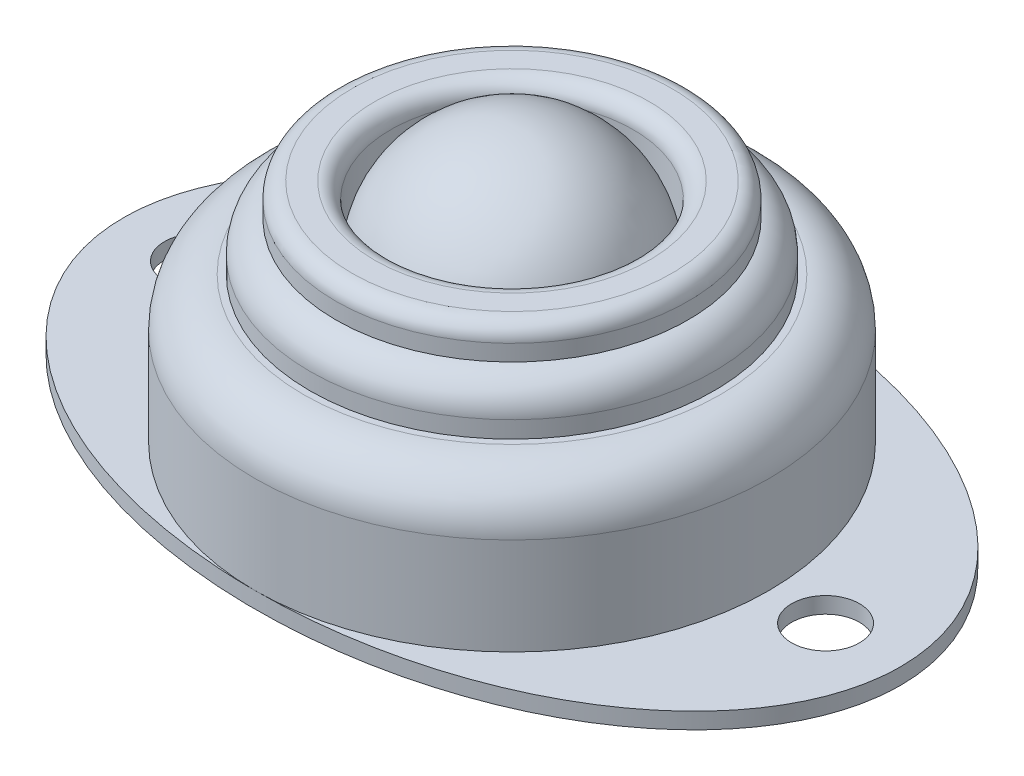
from build123d import *

# Parameters (mm, degrees)
SKETCH_1_RX         = 24.05
SKETCH_1_RY         = 15.9
SKETCH_1_R          = 2.1
EXTRUDE_1_DEPTH     = 1
SKETCH_1_3_R        = 15.9
EXTRUDE_2_DEPTH     = 15
SKETCH_2_R          = 7.5
CUT_EXTRUDE_2_DEPTH = 12
SKETCH_5_R          = 7.5
EXTRUDE_4_DEPTH     = 15
FILLET_4_R          = 7.5
CUT_EXTRUDE_START   = -5
SKETCH_6_R          = 15.9
SKETCH_6_R_2        = 12.5
CUT_EXTRUDE_3_DEPTH = 5
CUT_EXTRUDE_START_2 = -2
SKETCH_7_R          = 12.5
SKETCH_7_R_2        = 10.9
CUT_EXTRUDE_4_DEPTH = 2
FILLET_5_R          = 1
FILLET_8_R          = 3
FILLET_9_R          = 2


# Some blends are built 0.0001 mm under size
with BuildPart() as part:
    # 草图1 → 凸台-拉伸1 (new body)
    with BuildSketch(Plane(origin=(0, 0, 0), x_dir=(1, 0, 0), z_dir=(0, 1, 0))):
        with Locations((0, 0)):
            Ellipse(SKETCH_1_RX, SKETCH_1_RY)
        with Locations(Location((-19.4, 0, 0), (0, 0, 270))):
            Circle(SKETCH_1_R, mode=Mode.SUBTRACT)
        with Locations(Location((19.4, 0, 0), (0, 0, 270))):
            Circle(SKETCH_1_R, mode=Mode.SUBTRACT)
    extrude(amount=EXTRUDE_1_DEPTH)

    # 草图1<3> → 凸台-拉伸2 (add)
    with BuildSketch(Plane(origin=(0, 0, 0), x_dir=(1, 0, 0), z_dir=(0, 1, 0))):
        with Locations(Location((0, 0, 0), (0, 0, 270))):
            Circle(SKETCH_1_3_R)
    extrude(amount=EXTRUDE_2_DEPTH)

    # 草图2 → 切除-拉伸2 (cut)
    with BuildSketch(Plane(origin=(0, 15, 0), x_dir=(1, 0, 0), z_dir=(0, 1, 0))):
        with Locations(Location((0, 0, 0), (0, 0, 270))):
            Circle(SKETCH_2_R)
    extrude(amount=-CUT_EXTRUDE_2_DEPTH, mode=Mode.SUBTRACT)

    # 草图6 → 切除-拉伸3 (cut)
    with BuildSketch(Plane(origin=(0, 15, 0), x_dir=(1, 0, 0), z_dir=(0, 1, 0)).offset(CUT_EXTRUDE_START)):
        with Locations(Location((0, 0, 0), (0, 0, 270))):
            Circle(SKETCH_6_R)
        with Locations(Location((0, 0, 0), (0, 0, 270))):
            Circle(SKETCH_6_R_2, mode=Mode.SUBTRACT)
    extrude(amount=CUT_EXTRUDE_3_DEPTH, mode=Mode.SUBTRACT)

    # 草图7 → 切除-拉伸4 (cut)
    with BuildSketch(Plane(origin=(0, 15, 0), x_dir=(1, 0, 0), z_dir=(0, 1, 0)).offset(CUT_EXTRUDE_START_2)):
        with Locations(Location((0, 0, 0), (0, 0, 270))):
            Circle(SKETCH_7_R)
        with Locations(Location((0, 0, 0), (0, 0, 270))):
            Circle(SKETCH_7_R_2, mode=Mode.SUBTRACT)
    extrude(amount=CUT_EXTRUDE_4_DEPTH, mode=Mode.SUBTRACT)

    # 圆角5
    fillet_5_edges = [part.edges().sort_by_distance(p)[0] for p in [
        (0, 15, -7.5),
        (0, 15, -10.9),
    ]]
    fillet(fillet_5_edges, radius=FILLET_5_R)

    # 圆角8
    fillet_8_edges = [part.edges().sort_by_distance(p)[0] for p in [
        (0, 10, -15.9),
    ]]
    fillet(fillet_8_edges, radius=FILLET_8_R)

    # 圆角9
    # the kernel refuses this fillet: 2 mm, written as the material it takes off along each edge
    with BuildSketch(Plane(origin=(0, 13, 0), x_dir=(0, 0, 1), z_dir=(-1, 0, 0))) as fillet_9_piece_1:
        with BuildLine():
            CenterArc((10.5, -1.959591794), FILLET_9_R, 0, 78.463040967)
            Line((10.9, 0), (10.908, 0.039191836))
            ThreePointArc((10.908, 0.039191836), (11.7, 0.04), (12.5, 0.04))
            Line((12.5, 0.04), (12.54, 0))
            Line((12.54, 0), (12.54, -1.959591794))
            Line((12.54, -1.959591794), (12.5, -1.959591794))
        make_face()
    revolve(axis=Axis((0, 13, 0), (0, 1, 0)), mode=Mode.SUBTRACT)


with BuildPart() as body_2:
    # 草图5 → 凸台-拉伸4 (new body)
    with BuildSketch(Plane(origin=(0, 3, 0), x_dir=(1, 0, 0), z_dir=(0, 1, 0))):
        with Locations(Location((0, 0, 0), (0, 0, 270))):
            Circle(SKETCH_5_R)
    extrude(amount=EXTRUDE_4_DEPTH)

    # 圆角4
    fillet_4_edges = [body_2.edges().sort_by_distance(p)[0] for p in [
        (0, 3, -7.5),
        (0, 18, -7.5),
    ]]
    fillet(fillet_4_edges, radius=FILLET_4_R - 0.0001)  # a hair under: the kernel refuses the full size


solid = Compound([part.part, body_2.part])
